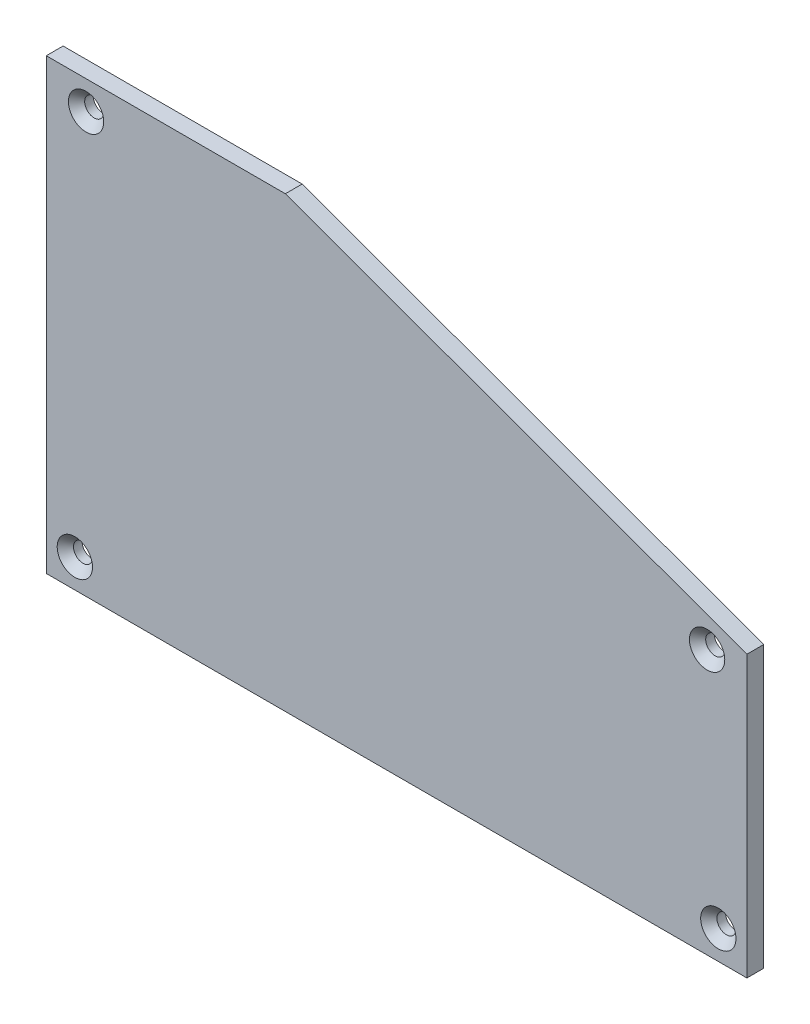
from build123d import *

# Parameters (mm, degrees)
EXTRUDE_1_DEPTH            = 3
HOLE_WIZARD_M31_AT_2_COUNT = 2
HOLE_WIZARD_M31_AT_2_PITCH = 69.828647416
HOLE_WIZARD_M31_AT_3_COUNT = 2
HOLE_WIZARD_M31_AT_3_PITCH = 114.213472497
HOLE_WIZARD_M31_AT_4_COUNT = 2
HOLE_WIZARD_M31_AT_4_PITCH = 132.649462871


with BuildPart() as part:
    # Эскиз1 → Бобышка-Вытянуть1 (new body)
    with BuildSketch(Plane.XY):
        Polygon((-53.75, 74), (-11.094891825, 74), (71.25, 44.028910432), (71.25, -6), (-53.75, -6), align=None)
    extrude(amount=EXTRUDE_1_DEPTH)

    # Эскиз5 → Зенковка для винта с потайной головкой M31 (revolve, cut)
    with BuildSketch(Plane(origin=(-46.65, 68.9, 3), x_dir=(0, -1, 0), z_dir=(1, 0, 0))):
        Polygon((0, 0), (0, 3), (1.7, 3), (1.7, 1.45), (3.15, 0), align=None)
    hole_wizard_m31 = revolve(axis=Axis((-46.65, 68.9, 9.35), (0, 0, -1)), mode=Mode.SUBTRACT)

    # Зенковка для винта с потайной головкой M31 at 2: Зенковка для винта с потайной головкой M31 ×2
    with Locations(*[Vector(-0.0286415400268957, -0.9995897469386568, 0) * (i * HOLE_WIZARD_M31_AT_2_PITCH) for i in range(1, HOLE_WIZARD_M31_AT_2_COUNT)]):
        add(hole_wizard_m31, mode=Mode.SUBTRACT)

    # Зенковка для винта с потайной головкой M31 at 3: Зенковка для винта с потайной головкой M31 ×2
    with Locations(*[Vector(0.9701132237525701, -0.2426527005833562, 0) * (i * HOLE_WIZARD_M31_AT_3_PITCH) for i in range(1, HOLE_WIZARD_M31_AT_3_COUNT)]):
        add(hole_wizard_m31, mode=Mode.SUBTRACT)

    # Зенковка для винта с потайной головкой M31 at 4: Зенковка для винта с потайной головкой M31 ×2
    with Locations(*[Vector(0.8503615284864277, -0.5261988890811407, 0) * (i * HOLE_WIZARD_M31_AT_4_PITCH) for i in range(1, HOLE_WIZARD_M31_AT_4_COUNT)]):
        add(hole_wizard_m31, mode=Mode.SUBTRACT)


solid = part.part
